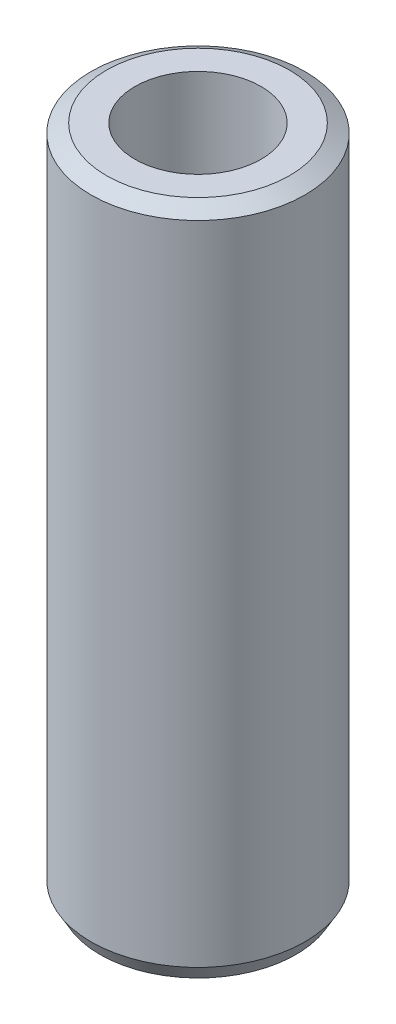
from build123d import *
from OCP.BRepFilletAPI import BRepFilletAPI_MakeChamfer

# Parameters (mm, degrees)
SKETCH1_R           = 60
BOSS_EXTRUDE1_DEPTH = 376.550034024
SKETCH2_R           = 35.390543829
CUT_EXTRUDE1_DEPTH  = 386.992134795
CHAMFER1_SIZE       = 5.013382326
CHAMFER1_SIZE2      = 8.683432906


with BuildPart() as part:
    # Sketch1 → Boss-Extrude1 (new body)
    with BuildSketch(Plane(origin=(0, 0, 0), x_dir=(1, 0, 0), z_dir=(0, 1, 0))):
        Circle(SKETCH1_R)
    extrude(amount=BOSS_EXTRUDE1_DEPTH)

    # Sketch2 → Cut-Extrude1 (cut, through all)
    with BuildSketch(Plane(origin=(0, 0, 0), x_dir=(1, 0, 0), z_dir=(0, 1, 0))):
        Circle(SKETCH2_R)
    extrude(amount=CUT_EXTRUDE1_DEPTH, mode=Mode.SUBTRACT)

    # Chamfer1: one chamfer whose edges measure the first distance from different faces: ONE call of the kernel's chamfer builder (chamfer() names one face for all edges)
    chamfer1_edges_1 = [part.edges().sort_by_distance(p)[0] for p in [
        (-60, 376.550034024, 0),
    ]]
    chamfer1_side_1 = [part.faces().sort_by_distance(p)[0] for p in [
        (-60, 188.275017012, 0),
    ]]
    chamfer1_edges_2 = [part.edges().sort_by_distance(p)[0] for p in [
        (-60, 0, 0),
    ]]
    chamfer1_side_2 = [part.faces().sort_by_distance(p)[0] for p in [
        (-58.302943725, 0, 0),
    ]]
    chamfer1 = BRepFilletAPI_MakeChamfer(part.part.solid().wrapped)
    for e in chamfer1_edges_1:
        chamfer1.Add(CHAMFER1_SIZE, CHAMFER1_SIZE2, e.wrapped, chamfer1_side_1[0].wrapped)  # the first distance lies on this face
    for e in chamfer1_edges_2:
        chamfer1.Add(CHAMFER1_SIZE, CHAMFER1_SIZE2, e.wrapped, chamfer1_side_2[0].wrapped)  # the first distance lies on this face
    add(Compound.cast(chamfer1.Shape()), mode=Mode.REPLACE)


solid = part.part
